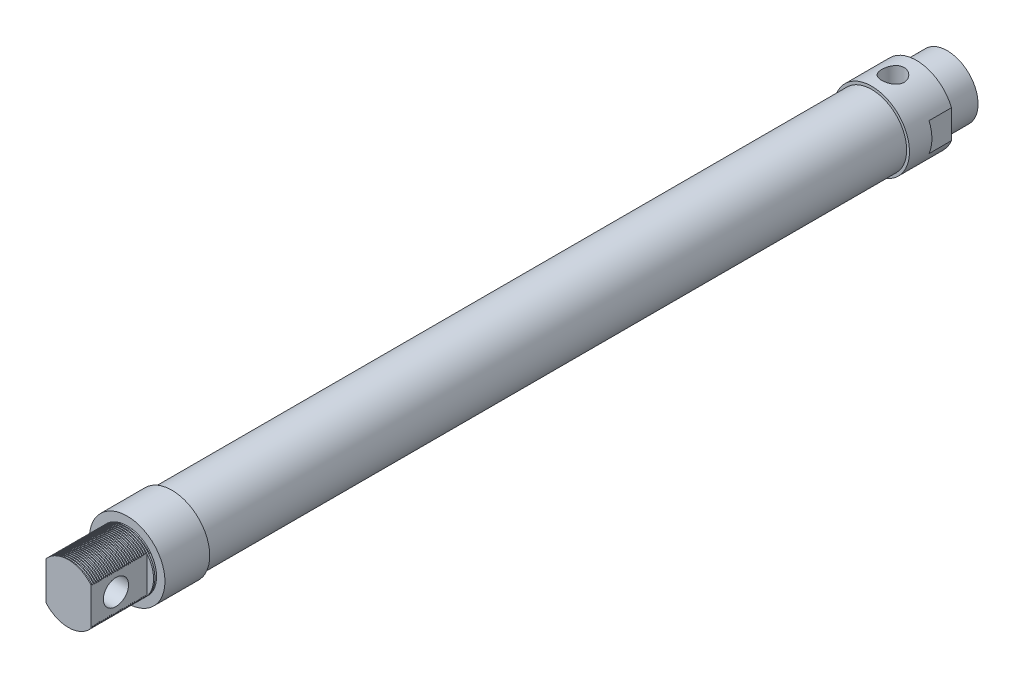
from build123d import *

# Parameters (mm, degrees)
SKETCH1_R           = 12.5
BOSS_EXTRUDE1_DEPTH = 250
SKETCH2_R           = 13.5
BOSS_EXTRUDE2_DEPTH = 16
SKETCH3_R           = 10.5
BOSS_EXTRUDE3_DEPTH = 1
BOSS_EXTRUDE4_DEPTH = 20
SKETCH5_R           = 4.5
CUT_EXTRUDE1_DEPTH  = 289.120634457
CUT_SWEEP1_PITCH    = 0.75
BOSS_EXTRUDE5_START = 8
SKETCH9_R           = 13.5
BOSS_EXTRUDE5_DEPTH = 8
BOSS_EXTRUDE6_START = 8
BOSS_EXTRUDE6_DEPTH = 8
SKETCH11_R          = 11
BOSS_EXTRUDE7_DEPTH = 11
SKETCH14_R          = 4
CUT_EXTRUDE2_DEPTH  = 6
SKETCH16_R          = 4
CUT_EXTRUDE4_DEPTH  = 100


with BuildPart() as part:
    # Sketch1 → Boss-Extrude1 (new body)
    with BuildSketch(Plane.XY):
        Circle(SKETCH1_R)
    extrude(amount=BOSS_EXTRUDE1_DEPTH)

    # Sketch2 → Boss-Extrude2 (add)
    with BuildSketch(Plane.XY.offset(250)):
        Circle(SKETCH2_R)
    extrude(amount=BOSS_EXTRUDE2_DEPTH)

    # Sketch3 → Boss-Extrude3 (add)
    with BuildSketch(Plane.XY.offset(266)):
        Circle(SKETCH3_R)
    extrude(amount=BOSS_EXTRUDE3_DEPTH)

    # Sketch4 → Boss-Extrude4 (add)
    with BuildSketch(Plane.XY.offset(267)):
        with BuildLine():
            Line((-8, 6.800735254), (-8, -6.800735254))
            ThreePointArc((-8, -6.800735254), (0, -10.5), (8, -6.800735254))
            Line((8, -6.800735254), (8, 6.800735254))
            ThreePointArc((8, 6.800735254), (0, 10.5), (-8, 6.800735254))
        make_face()
    extrude(amount=BOSS_EXTRUDE4_DEPTH)

    # Sketch5 → Cut-Extrude1 (cut, through all)
    with BuildSketch(Plane.ZY.offset(8)):
        with Locations((278, 0)):
            Circle(SKETCH5_R)
    extrude(amount=-CUT_EXTRUDE1_DEPTH, mode=Mode.SUBTRACT)

    # Cut-Sweep1: the profile of Sketch8 screwed along a right-hand helix of 27.5 turns, 8 arcs to a turn; built about Z, then put on its axis
    cut_sweep1_z = Axis((0, 0, 0), (0, 0, 1))
    cut_sweep1_corners = [(10.521079818, -0.00529273, 0.465572819), (10.5, 0, 0), (10.109141319, -0.002781345, 0.244659921)]
    with BuildLine(mode=Mode.PRIVATE) as cut_sweep1_profile:
        Line(cut_sweep1_corners[0], cut_sweep1_corners[1])
        Line(cut_sweep1_corners[1], cut_sweep1_corners[2])
        Line(cut_sweep1_corners[2], cut_sweep1_corners[0])
    cut_sweep1_cap = Face(cut_sweep1_profile.wire())
    cut_sweep1_turn_angles = [0, 22.5, 45, 67.5, 90, 112.5, 135, 157.5, 180, 202.5, 225, 247.5, 270, 292.5, 315, 337.5, 360]
    cut_sweep1_turn_weights = [1, 0.9238795325112867, 1, 0.9238795325112867, 1, 0.9238795325112867, 1, 0.9238795325112867, 1, 0.9238795325112867, 1, 0.9238795325112867, 1, 0.9238795325112867, 1, 0.9238795325112867, 1]
    cut_sweep1_turn_rails = [Edge.make_bspline([Vector(p[0], p[1], 0).rotate(cut_sweep1_z, cut_sweep1_turn_angles[k]) / cut_sweep1_turn_weights[k] + Vector(0, 0, p[2] + CUT_SWEEP1_PITCH * cut_sweep1_turn_angles[k] / 360) for k in range(17)], [0, 0, 0, 1, 1, 2, 2, 3, 3, 4, 4, 5, 5, 6, 6, 7, 7, 8, 8, 8], 2, cut_sweep1_turn_weights) for p in cut_sweep1_corners]
    cut_sweep1_turn_sides = [Face.make_surface_from_curves(cut_sweep1_turn_rails[p[0]], cut_sweep1_turn_rails[p[1]]) for p in [(0, 1), (1, 2), (2, 0)]]
    cut_sweep1_last_angles = [9720, 9742.5, 9765, 9787.5, 9810, 9832.5, 9855, 9877.5, 9900]
    cut_sweep1_last_weights = [1, 0.9238795325112867, 1, 0.9238795325112867, 1, 0.9238795325112867, 1, 0.923879532511311, 1]
    cut_sweep1_last_rails = [Edge.make_bspline([Vector(p[0], p[1], 0).rotate(cut_sweep1_z, cut_sweep1_last_angles[k]) / cut_sweep1_last_weights[k] + Vector(0, 0, p[2] + CUT_SWEEP1_PITCH * cut_sweep1_last_angles[k] / 360) for k in range(9)], [0, 0, 0, 1, 1, 2, 2, 3, 3, 4, 4, 4], 2, cut_sweep1_last_weights) for p in cut_sweep1_corners]
    cut_sweep1_last_sides = [Face.make_surface_from_curves(cut_sweep1_last_rails[p[0]], cut_sweep1_last_rails[p[1]]) for p in [(0, 1), (1, 2), (2, 0)]]
    cut_sweep1 = Plane(origin=(0, 0, 287), x_dir=(-0.7986355100472996, -0.6018150231520395, 0), z_dir=(0, 0, -1)) * Solid(Shell([*[p.moved(Location((0, 0, CUT_SWEEP1_PITCH * i))) for i in range(27) for p in cut_sweep1_turn_sides], *cut_sweep1_last_sides, cut_sweep1_cap, cut_sweep1_cap.rotate(cut_sweep1_z, 9900).moved(Location((0, 0, CUT_SWEEP1_PITCH * 9900 / 360)))]))
    add(cut_sweep1, mode=Mode.SUBTRACT)

    # Sketch9 → Boss-Extrude5 (add)
    with BuildSketch(Plane(origin=(0, 0, 0), x_dir=(-1, 0, 0), z_dir=(0, 0, -1)).offset(BOSS_EXTRUDE5_START)):
        with Locations(Location((0, 0, 0), (0, 0, 180))):
            Circle(SKETCH9_R)
    extrude(amount=-BOSS_EXTRUDE5_DEPTH)

    # Sketch10 → Boss-Extrude6 (add)
    with BuildSketch(Plane(origin=(0, 0, -8), x_dir=(-1, 0, 0), z_dir=(0, 0, -1)).offset(BOSS_EXTRUDE6_START)):
        with BuildLine():
            Line((12.5, -5.099019514), (12.5, 5.099019514))
            ThreePointArc((12.5, 5.099019514), (0, 13.5), (-12.5, 5.099019514))
            Line((-12.5, 5.099019514), (-12.5, -5.099019514))
            ThreePointArc((-12.5, -5.099019514), (0, -13.5), (12.5, -5.099019514))
        make_face()
    extrude(amount=-BOSS_EXTRUDE6_DEPTH)

    # Sketch11 → Boss-Extrude7 (add)
    with BuildSketch(Plane(origin=(0, 0, -16), x_dir=(-1, 0, 0), z_dir=(0, 0, -1))):
        Circle(SKETCH11_R)
    extrude(amount=BOSS_EXTRUDE7_DEPTH)

    # Sketch14 → Cut-Extrude2 (cut)
    with BuildSketch(Plane(origin=(0, 13.5, 0), x_dir=(-1, 0, 0), z_dir=(0, 1, 0))):
        with Locations(Location((0, -7.593677218, 0), (0, 0, 90))):
            Circle(SKETCH14_R)
    extrude(amount=-CUT_EXTRUDE2_DEPTH, mode=Mode.SUBTRACT)

    # Sketch16 → Cut-Extrude4 (cut)
    with BuildSketch(Plane(origin=(0, 0, -27), x_dir=(-1, 0, 0), z_dir=(0, 0, -1))):
        Circle(SKETCH16_R)
    extrude(amount=-CUT_EXTRUDE4_DEPTH, mode=Mode.SUBTRACT)


solid = part.part
